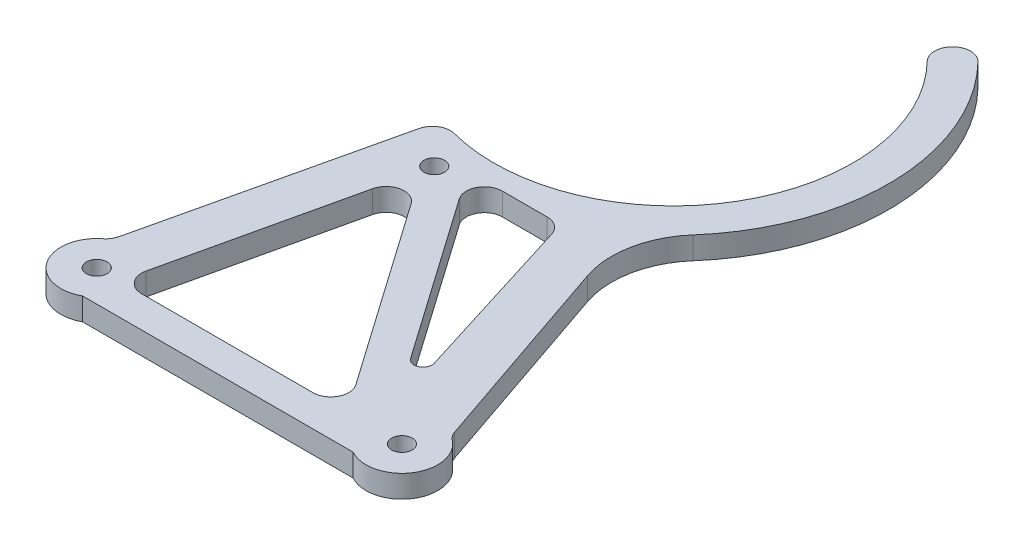
from build123d import *

# Parameters (mm, degrees)
SKETCH1_R           = 5.08
SKETCH1_R_2         = 1.4605
BOSS_EXTRUDE1_DEPTH = 3.175
BOSS_EXTRUDE3_START = -3.175
BOSS_EXTRUDE3_DEPTH = 3.175
CUT_EXTRUDE1_DEPTH  = 25.4
FILLET4_R           = 2.54
FILLET5_R           = 12.7
FILLET6_R           = 2.54
FILLET7_R           = 1.27
SKETCH5_R           = 1.4605
CUT_EXTRUDE2_DEPTH  = 25.4


with BuildPart() as part:
    # Sketch1 → Boss-Extrude1 (new body)
    # profile 1 of 3: a face of its own
    with BuildSketch(Plane(origin=(0, 0, 0), x_dir=(1, 0, 0), z_dir=(0, 1, 0))):
        Circle(SKETCH1_R)
        with Locations(Location((0, 0, 0), (0, 0, 270))):
            Circle(SKETCH1_R_2, mode=Mode.SUBTRACT)
    # profile 2 of 3: a face of its own
    with BuildSketch(Plane(origin=(0, 0, 0), x_dir=(1, 0, 0), z_dir=(0, 1, 0))):
        with BuildLine():
            Line((40.720655575, 4.445), (2.459344425, 4.445))
            ThreePointArc((2.459344425, 4.445), (4.376063852, 2.580012628), (5.08, 0))
            ThreePointArc((5.08, 0), (4.376063852, -2.580012628), (2.459344425, -4.445))
            Line((2.459344425, -4.445), (40.720655575, -4.445))
            ThreePointArc((40.720655575, -4.445), (38.1, 0), (40.720655575, 4.445))
        make_face()
    # profile 3 of 3: a face of its own
    with BuildSketch(Plane(origin=(0, 0, 0), x_dir=(1, 0, 0), z_dir=(0, 1, 0))):
        with Locations((43.18, 0)):
            Circle(SKETCH1_R)
        with Locations(Location((43.18, 0, 0), (0, 0, 270))):
            Circle(SKETCH1_R_2, mode=Mode.SUBTRACT)
    extrude(amount=BOSS_EXTRUDE1_DEPTH)

    # Sketch3 → Boss-Extrude3 (add)
    with BuildSketch(Plane(origin=(0, 3.175, 0), x_dir=(1, 0, 0), z_dir=(0, 1, 0)).offset(BOSS_EXTRUDE3_START)):
        with BuildLine():
            Line((35.04998037, 89.507820887), (31.75, 85.645628562))
            ThreePointArc((31.75, 85.645628562), (37.132860765, 53.438748965), (6.35, 42.545))
            Line((6.35, 42.545), (-2.459344425, 4.445))
            ThreePointArc((-2.459344425, 4.445), (0, 5.08), (2.459344425, 4.445))
            Line((2.459344425, 4.445), (35.640655575, 4.445))
            Line((35.640655575, 4.445), (40.720655575, 4.445))
            ThreePointArc((40.720655575, 4.445), (43.226324552, 5.079788779), (45.72, 4.399409051))
            Line((45.72, 4.399409051), (33.02, 41.570560083))
            ThreePointArc((33.02, 41.570560083), (45.702805946, 65.04509807), (35.04998037, 89.507820887))
        make_face()
    extrude(amount=BOSS_EXTRUDE3_DEPTH)

    # Sketch4 → Cut-Extrude1 (cut)
    with BuildSketch(Plane(origin=(0, 3.175, 0), x_dir=(1, 0, 0), z_dir=(0, 1, 0))):
        Polygon((14.401426857, 38.1), (37.998834682, 4.399409051), (27.495360016, 38.1), align=None)
        Polygon((3.175, 0), (35.458834682, 0), (11.089851742, 34.802514411), align=None)
    extrude(amount=-CUT_EXTRUDE1_DEPTH, mode=Mode.SUBTRACT)

    # Fillet4
    fillet4_edges = [part.edges().sort_by_distance(p)[0] for p in [
        (11.089851742, 1.5875, -34.802514411),
        (35.458834682, 1.5875, 0),
        (3.175, 1.5875, 0),
        (14.401426857, 1.5875, -38.1),
        (27.495360016, 1.5875, -38.1),
    ]]
    fillet(fillet4_edges, radius=FILLET4_R)

    # Fillet5
    fillet5_edges = [part.edges().sort_by_distance(p)[0] for p in [
        (33.02, 1.5875, -41.570560083),
    ]]
    fillet(fillet5_edges, radius=FILLET5_R)

    # Fillet6
    fillet6_edges = [part.edges().sort_by_distance(p)[0] for p in [
        (6.35, 1.5875, -42.545),
        (35.04998037, 1.5875, -89.507820887),
        (31.75, 1.5875, -85.645628562),
        (-2.459344425, 1.5875, -4.445),
        (45.72, 1.5875, -4.399409051),
    ]]
    fillet(fillet6_edges, radius=FILLET6_R - 0.0001)  # a hair under: the kernel refuses the full size

    # Fillet7
    fillet7_edges = [part.edges().sort_by_distance(p)[0] for p in [
        (37.998834682, 1.5875, -4.399409051),
    ]]
    fillet(fillet7_edges, radius=FILLET7_R)

    # Sketch5 → Cut-Extrude2 (cut)
    with BuildSketch(Plane(origin=(0, 3.175, 0), x_dir=(1, 0, 0), z_dir=(0, 1, 0))):
        with Locations(Location((11.43, 36.322, 0), (0, 0, 270))):
            Circle(SKETCH5_R)
    extrude(amount=-CUT_EXTRUDE2_DEPTH, mode=Mode.SUBTRACT)


solid = part.part
